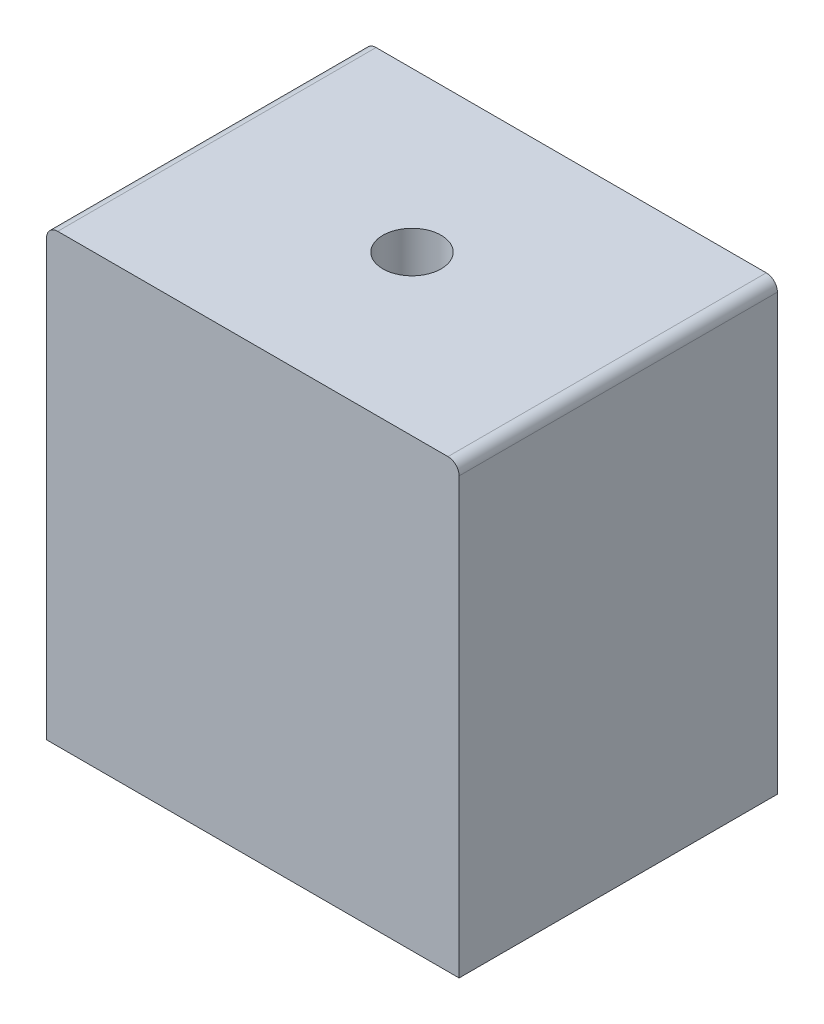
from build123d import *

# Parameters (mm, degrees)
SKETCH1_W           = 74
SKETCH1_H           = 57.1
BOSS_EXTRUDE1_DEPTH = 80
FILLET1_R           = 2
CUT_EXTRUDE1_REACH  = 94.65
SKETCH2_R           = 5.23


with BuildPart() as part:
    # Sketch1 → Boss-Extrude1 (new body)
    with BuildSketch(Plane(origin=(0, 0, 0), x_dir=(1, 0, 0), z_dir=(0, 1, 0))):
        Rectangle(SKETCH1_W, SKETCH1_H)
    extrude(amount=BOSS_EXTRUDE1_DEPTH)

    # Fillet1
    fillet1_edges = [part.edges().sort_by_distance(p)[0] for p in [
        (-37, 80, 0),
        (37, 80, 0),
    ]]
    fillet(fillet1_edges, radius=FILLET1_R)

    # Sketch2 → Cut-Extrude1 (cut, up to next)
    with BuildSketch(Plane(origin=(0, 80, 0), x_dir=(1, 0, 0), z_dir=(0, 1, 0)), mode=Mode.PRIVATE) as cut_extrude1_sk1:
        Circle(SKETCH2_R)
    cut_extrude1_tool1 = extrude(cut_extrude1_sk1.sketch, amount=-CUT_EXTRUDE1_REACH, mode=Mode.PRIVATE) & part.part
    add(cut_extrude1_tool1.solids().sort_by_distance((0, 80, 0))[0], mode=Mode.SUBTRACT)


solid = part.part
